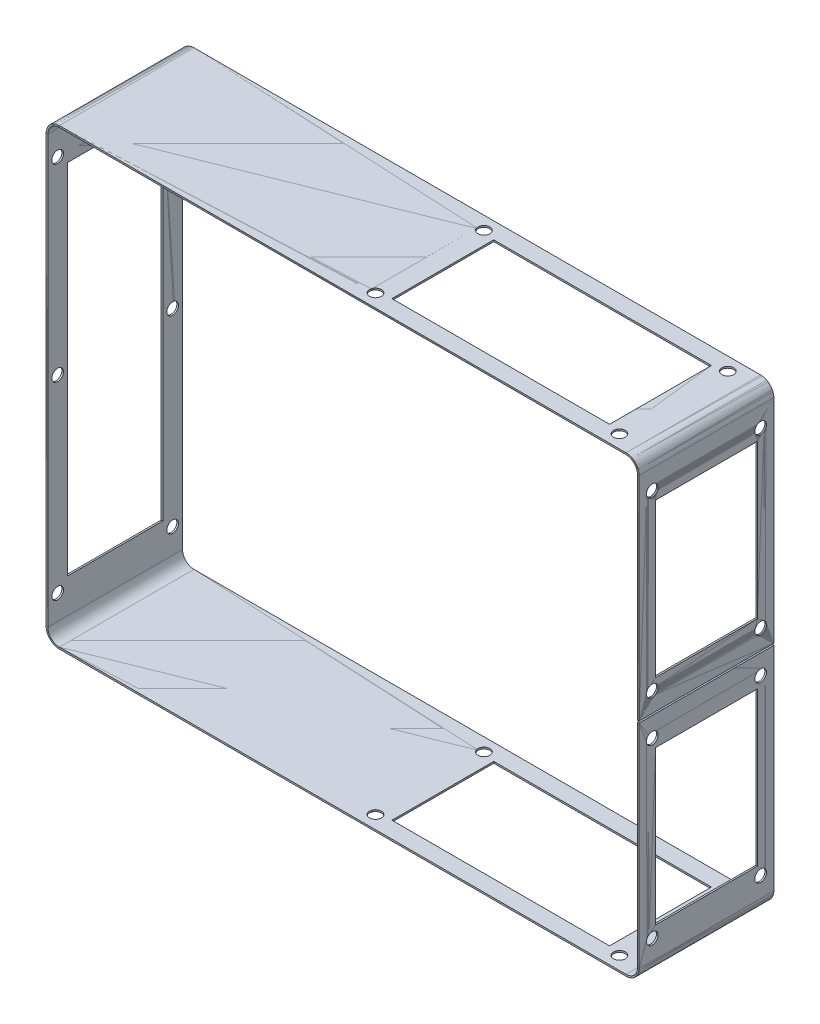
from build123d import *

# Parameters (mm, degrees)
PROFILE_W            = 361
PROFILE_H            = 276
BOSS_EXTRUDE1_DEPTH  = 82
FILLET2_R            = 8
CUT_EXTRUDE3_DEPTH   = 242.55382423
SKETCH46_W           = 3
SKETCH46_H           = 1
CUT_EXTRUDE4_DEPTH   = 242.55382423
CONVERT_SOLID8_DEPTH = 82
SKETCH51_R           = 3.55
SKETCH51_W           = 58
SKETCH51_H           = 218
FRONT_PANEL_DEPTH    = 1
SKETCH52_R           = 3.55
SKETCH52_W           = 62
SKETCH52_H           = 93.5
BACK_PLATE_DEPTH     = 10
SKETCH53_R           = 3.6
SKETCH53_W           = 132.5
SKETCH53_H           = 62
SIDE_PANEL_DEPTH     = 10


# Read off the part's stored shape, not the designer's step: Convert-Solid8
with BuildPart() as part:
    # profile → Boss-Extrude1 (new body)
    with BuildSketch(Plane.XY):
        Rectangle(PROFILE_W, PROFILE_H)
    extrude(amount=BOSS_EXTRUDE1_DEPTH)

    # Fillet2
    fillet2_edges = [part.edges().sort_by_distance(p)[0] for p in [
        (180.5, -138, 41),
        (-180.5, -138, 41),
        (-180.5, 138, 41),
        (180.5, 138, 41),
    ]]
    fillet(fillet2_edges, radius=FILLET2_R)

    # Sketch44 → Cut-Extrude3 (cut, through all)
    with BuildSketch(Plane.XY.offset(82)):
        with BuildLine():
            Line((172.5, 137), (-172.5, 137))
            ThreePointArc((-172.5, 137), (-177.449747468, 134.949747468), (-179.5, 130))
            Line((-179.5, 130), (-179.5, -130))
            ThreePointArc((-179.5, -130), (-177.449747468, -134.949747468), (-172.5, -137))
            Line((-172.5, -137), (172.5, -137))
            ThreePointArc((172.5, -137), (177.449747468, -134.949747468), (179.5, -130))
            Line((179.5, -130), (179.5, 130))
            ThreePointArc((179.5, 130), (177.449747468, 134.949747468), (172.5, 137))
        make_face()
    extrude(amount=-CUT_EXTRUDE3_DEPTH, mode=Mode.SUBTRACT)

    # Sketch46 → Cut-Extrude4 (cut, through all)
    with BuildSketch(Plane.XY.offset(82)):
        with Locations((180, 0)):
            Rectangle(SKETCH46_W, SKETCH46_H)
    extrude(amount=-CUT_EXTRUDE4_DEPTH, mode=Mode.SUBTRACT)


with BuildPart() as body_2:
    # Convert-Solid8 outline → Convert-Solid8 (new body)
    with BuildSketch(Plane.XY):
        with BuildLine():
            Line((180.5, -130), (180.5, -0.5))
            Line((180.5, -0.5), (179.5, -0.5))
            Line((179.5, -0.5), (179.5, -130))
            ThreePointArc((179.5, -130), (177.449747468, -134.949747468), (172.5, -137))
            Line((172.5, -137), (-172.5, -137))
            ThreePointArc((-172.5, -137), (-177.449747468, -134.949747468), (-179.5, -130))
            Line((-179.5, -130), (-179.5, 130))
            ThreePointArc((-179.5, 130), (-177.449747468, 134.949747468), (-172.5, 137))
            Line((-172.5, 137), (172.5, 137))
            ThreePointArc((172.5, 137), (177.449747468, 134.949747468), (179.5, 130))
            Line((179.5, 130), (179.5, 0.5))
            Line((179.5, 0.5), (180.5, 0.5))
            Line((180.5, 0.5), (180.5, 130))
            ThreePointArc((180.5, 130), (178.156854249, 135.656854249), (172.5, 138))
            Line((172.5, 138), (-172.5, 138))
            ThreePointArc((-172.5, 138), (-178.156854249, 135.656854249), (-180.5, 130))
            Line((-180.5, 130), (-180.5, -130))
            ThreePointArc((-180.5, -130), (-178.156854249, -135.656854249), (-172.5, -138))
            Line((-172.5, -138), (172.5, -138))
            ThreePointArc((172.5, -138), (178.156854249, -135.656854249), (180.5, -130))
        make_face()
    extrude(amount=CONVERT_SOLID8_DEPTH)


with BuildPart() as front_panel_tool:
    # Sketch51 → Front-Panel (new body)
    with BuildSketch(Plane.ZY.offset(180.5)):
        with Locations((76, 115)):
            Circle(SKETCH51_R)
        with Locations(Location((6, 115, 0), (0, 0, 180))):
            Circle(SKETCH51_R)
        with Locations(Location((76, -115, 0), (0, 0, 180))):
            Circle(SKETCH51_R)
        with Locations((6, -115)):
            Circle(SKETCH51_R)
        with Locations((76, 0)):
            Circle(SKETCH51_R)
        with Locations(Location((6, 0, 0), (0, 0, 180))):
            Circle(SKETCH51_R)
        with Locations((41, 0)):
            Rectangle(SKETCH51_W, SKETCH51_H)
    extrude(amount=-FRONT_PANEL_DEPTH)


with BuildPart() as part_1:
    add(part.part)

    # Front-Panel: cut by front_panel_tool
    add(front_panel_tool.part, mode=Mode.SUBTRACT)


with BuildPart() as body_2_1:
    add(body_2.part)

    # Front-Panel: cut by front_panel_tool
    add(front_panel_tool.part, mode=Mode.SUBTRACT)


with BuildPart() as back_plate_tool:
    # Sketch52 → Back-Plate (new, symmetric)
    with BuildSketch(Plane(origin=(180.5, 0, 0), x_dir=(0, 0, -1), z_dir=(1, 0, 0))):
        with Locations((-74, 118)):
            Circle(SKETCH52_R)
        with Locations((-8, 118)):
            Circle(SKETCH52_R)
        with Locations((-8, 12.5)):
            Circle(SKETCH52_R)
        with Locations((-74, 12.5)):
            Circle(SKETCH52_R)
        with Locations((-41, 65.25)):
            Rectangle(SKETCH52_W, SKETCH52_H)
    back_plate = extrude(amount=BACK_PLATE_DEPTH, both=True)


with BuildPart() as part_2:
    add(part_1.part)

    # Back-Plate: cut by back_plate_tool
    add(back_plate_tool.part, mode=Mode.SUBTRACT)


with BuildPart() as body_2_2:
    add(body_2_1.part)

    # Back-Plate: cut by back_plate_tool
    add(back_plate_tool.part, mode=Mode.SUBTRACT)


with BuildPart() as mirror1_tool:
    # Mirror1: Back-Plate across plane
    add(back_plate.mirror(Plane.ZX))


with BuildPart() as part_3:
    add(part_2.part)

    # Mirror1: cut by mirror1_tool
    add(mirror1_tool.part, mode=Mode.SUBTRACT)


with BuildPart() as body_2_3:
    add(body_2_2.part)

    # Mirror1: cut by mirror1_tool
    add(mirror1_tool.part, mode=Mode.SUBTRACT)


with BuildPart() as side_panel_tool:
    # Sketch53 → Side-Panel (new body)
    with BuildSketch(Plane(origin=(0, 138, 0), x_dir=(1, 0, 0), z_dir=(0, 1, 0))):
        with Locations(Location((160.5, -8, 0), (0, 0, 270))):
            Circle(SKETCH53_R)
        with Locations(Location((12, -8, 0), (0, 0, 270))):
            Circle(SKETCH53_R)
        with Locations(Location((160.5, -74, 0), (0, 0, 270))):
            Circle(SKETCH53_R)
        with Locations(Location((12, -74, 0), (0, 0, 270))):
            Circle(SKETCH53_R)
        with Locations((86.25, -41)):
            Rectangle(SKETCH53_W, SKETCH53_H)
    side_panel = extrude(amount=-SIDE_PANEL_DEPTH)


with BuildPart() as part_4:
    add(part_3.part)

    # Side-Panel: cut by side_panel_tool
    add(side_panel_tool.part, mode=Mode.SUBTRACT)


with BuildPart() as body_2_4:
    add(body_2_3.part)

    # Side-Panel: cut by side_panel_tool
    add(side_panel_tool.part, mode=Mode.SUBTRACT)


with BuildPart() as mirror2_tool:
    # Mirror2: Side-Panel across plane
    add(side_panel.mirror(Plane.ZX))


with BuildPart() as part_5:
    add(part_4.part)

    # Mirror2: cut by mirror2_tool
    add(mirror2_tool.part, mode=Mode.SUBTRACT)


with BuildPart() as body_2_5:
    add(body_2_4.part)

    # Mirror2: cut by mirror2_tool
    add(mirror2_tool.part, mode=Mode.SUBTRACT)


solid = Compound([part_5.part, body_2_5.part])
